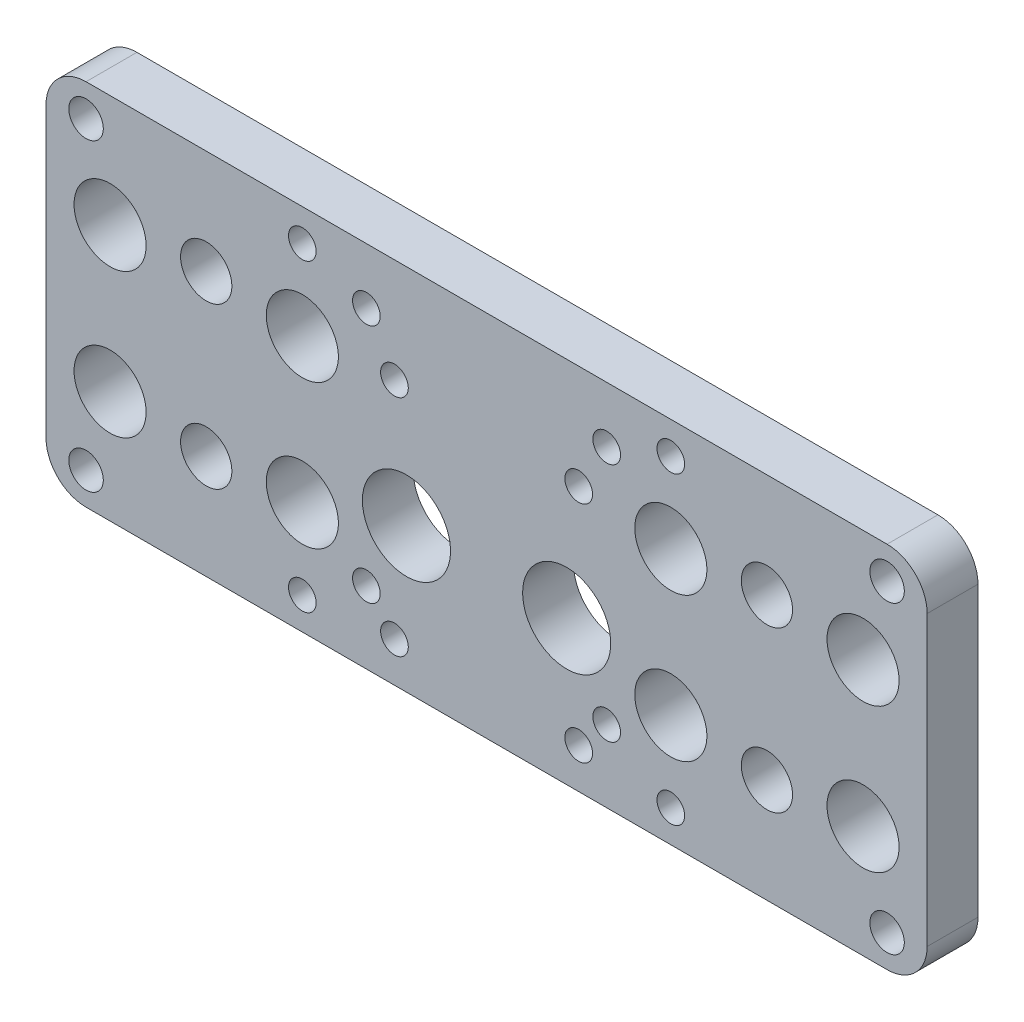
from build123d import *

# Parameters (mm, degrees)
SKETCH1_W             = 110
SKETCH1_H             = 46
BOSS_EXTRUDE1_DEPTH   = 6.35
M6_CLEARANCE_HOLE1_D  = 6.4
SKETCH5_R             = 5.5
CUT_EXTRUDE1_DEPTH    = 60.952668831
SKETCH7_R             = 4.5
CUT_EXTRUDE2_DEPTH    = 60.952668831
FILLET1_R             = 5
F_8_32_TAPPED_HOLE1_D = 3.4544
F_8_CLEARANCE_HOLE1_D = 4.3053
F_8_32_TAPPED_HOLE2_D = 3.4544


with BuildPart() as part:
    # Sketch1 → Boss-Extrude1 (new body)
    with BuildSketch(Plane.XY):
        Rectangle(SKETCH1_W, SKETCH1_H)
    extrude(amount=BOSS_EXTRUDE1_DEPTH)

    # M6 Clearance Hole1 (through all)
    with Locations(Plane(origin=(0, 0, 0), x_dir=(-1, 0, 0), z_dir=(0, 0, -1))):
        with Locations((-35, 10), (-35, -10), (35, -10), (35, 10)):
            Hole(M6_CLEARANCE_HOLE1_D / 2)

    # Sketch5 → Cut-Extrude1 (cut, through all)
    with BuildSketch(Plane(origin=(0, 0, 0), x_dir=(-1, 0, 0), z_dir=(0, 0, -1))):
        with Locations((-10, -5)):
            Circle(SKETCH5_R)
        with Locations((10, -5)):
            Circle(SKETCH5_R)
    extrude(amount=-CUT_EXTRUDE1_DEPTH, mode=Mode.SUBTRACT)

    # Sketch7 → Cut-Extrude2 (cut, through all)
    with BuildSketch(Plane(origin=(0, 0, 0), x_dir=(-1, 0, 0), z_dir=(0, 0, -1))):
        with Locations((-23, 9)):
            Circle(SKETCH7_R)
        with Locations((-23, -9)):
            Circle(SKETCH7_R)
        with Locations((23, -9)):
            Circle(SKETCH7_R)
        with Locations((23, 9)):
            Circle(SKETCH7_R)
        with Locations((-47, 9)):
            Circle(SKETCH7_R)
        with Locations((-47, -9)):
            Circle(SKETCH7_R)
        with Locations((47, 9)):
            Circle(SKETCH7_R)
        with Locations((47, -9)):
            Circle(SKETCH7_R)
    extrude(amount=-CUT_EXTRUDE2_DEPTH, mode=Mode.SUBTRACT)

    # Fillet1
    fillet1_edges = [part.edges().sort_by_distance(p)[0] for p in [
        (-55, 23, 3.175),
        (-55, -23, 3.175),
        (55, -23, 3.175),
        (55, 23, 3.175),
    ]]
    fillet(fillet1_edges, radius=FILLET1_R)

    # #8-32 Tapped Hole1 (through all)
    with Locations(Plane(origin=(0, 0, 0), x_dir=(-1, 0, 0), z_dir=(0, 0, -1))):
        with Locations((-23, 19), (23, 19), (23, -19), (-23, -19)):
            Hole(F_8_32_TAPPED_HOLE1_D / 2)

    # #8 Clearance Hole1 (through all)
    with Locations(Plane(origin=(0, 0, 0), x_dir=(-1, 0, 0), z_dir=(0, 0, -1))):
        with Locations((-50, 19), (-50, -19), (50, -19), (50, 19)):
            Hole(F_8_CLEARANCE_HOLE1_D / 2)

    # #8-32 Tapped Hole2 (through all)
    with Locations(Plane(origin=(0, 0, 0), x_dir=(-1, 0, 0), z_dir=(0, 0, -1))):
        with Locations((-11.5, 10), (11.5, 10), (11.5, -18), (-11.5, -18), (-15, -14), (15, -14), (15, 16), (-15, 16)):
            Hole(F_8_32_TAPPED_HOLE2_D / 2)


solid = part.part
